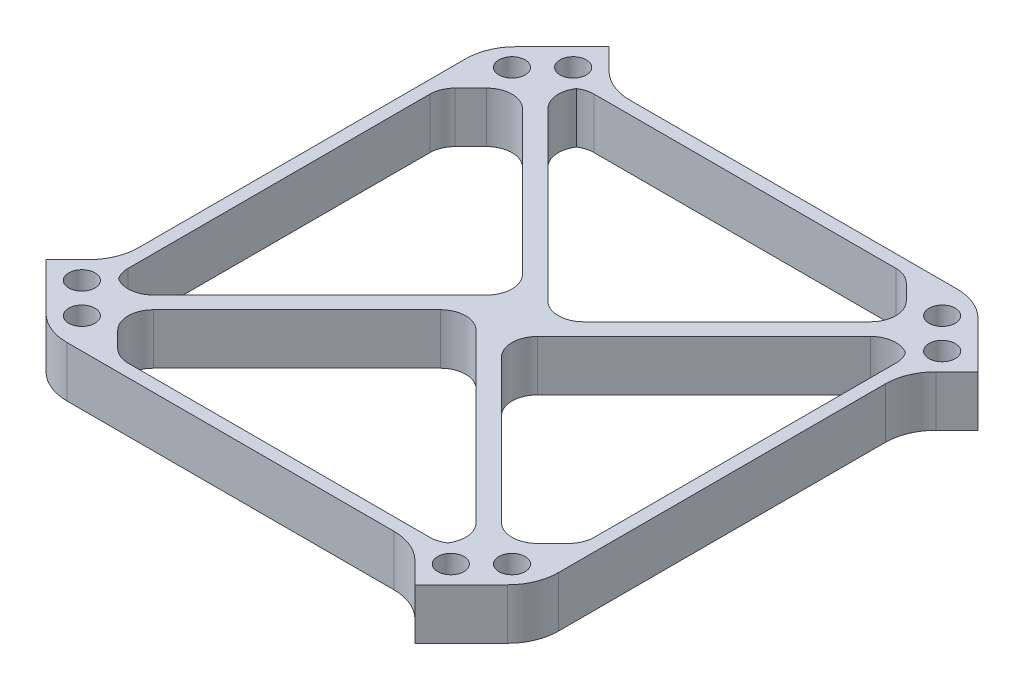
from build123d import *

# Parameters (mm, degrees)
BOSS_EXTRUDE1_DEPTH        = 10
CUT_EXTRUDE1_DEPTH         = 80.169628557
FILLET4_R                  = 5
CIRPATTERN6_COUNT          = 4
FILLET4_OF_CIRPATTERN6_R   = 5
FILLET5_R                  = 10
F_6_0_204_DIAMETER_HOLE1_D = 5.1816
CIRPATTERN7_COUNT          = 4


with BuildPart() as part:
    # Sketch1 → Boss-Extrude1 (new body)
    with BuildSketch(Plane(origin=(0, 0, 0), x_dir=(1, 0, 0), z_dir=(0, 1, 0))):
        Polygon((-48.461940777, 43.461940777), (-36.390872965, 55.533008589), (-29.319805153, 48.461940777), (43.461940777, 48.461940777), (55.533008589, 36.390872965), (48.461940777, 29.319805153), (48.461940777, -43.461940777), (36.390872965, -55.533008589), (29.319805153, -48.461940777), (-43.461940777, -48.461940777), (-55.533008589, -36.390872965), (-48.461940777, -29.319805153), align=None)
    extrude(amount=BOSS_EXTRUDE1_DEPTH)

    # Sketch2 → Cut-Extrude1 (cut, through all)
    with BuildSketch(Plane(origin=(0, 10, 0), x_dir=(1, 0, 0), z_dir=(0, 1, 0))):
        Polygon((-2.5, 4.571067812), (-42.426406871, -35.355339059), (-45.961940777, -31.819805153), (-45.961940777, 31.819805153), (-37.855339059, 39.926406871), align=None)
    cut_extrude1 = extrude(amount=-CUT_EXTRUDE1_DEPTH, mode=Mode.SUBTRACT)

    # Fillet4
    # the kernel refuses this fillet: 5 mm, written as the material it adds along each edge
    with BuildSketch(Plane(origin=(-37.855339059, 10, -39.926406871), x_dir=(-0.7071067811865468, 0, 0.7071067811865482), z_dir=(0, -1, 0)), Plane(origin=(-2.5, 10, -4.571067812), x_dir=(-0.7071067811865471, 0, -0.707106781186548), z_dir=(0, -1, 0))) as fillet4_piece_1:
        with BuildLine():
            CenterArc((FILLET4_R, -FILLET4_R), FILLET4_R, 90, 90)
            Line((0, -FILLET4_R), (0, 0))
            Line((0, 0), (FILLET4_R, 0))
        make_face()
    extrude(amount=10)
    with BuildSketch(Plane(origin=(-45.961940777, 10, 31.819805153), x_dir=(0.7071067811865467, 0, 0.7071067811865483), z_dir=(0, -1, 0)), Plane(origin=(-45.961940777, 10, -31.819805153), x_dir=(0, 0, 1), z_dir=(0, -1, 0))) as fillet4_piece_2:
        with BuildLine():
            CenterArc((FILLET4_R * 0.414213562373, -FILLET4_R), FILLET4_R, 90, 45)
            Line((-FILLET4_R * 0.292893218813, -FILLET4_R * 0.292893218813), (0, 0))
            Line((0, 0), (FILLET4_R * 0.414213562373, 0))
        make_face()
    extrude(amount=10)
    with BuildSketch(Plane(origin=(-42.426406871, 10, 35.355339059), x_dir=(-0.707106781186546, 0, -0.7071067811865489), z_dir=(0, -1, 0))) as fillet4_piece_3:
        with BuildLine():
            CenterArc((FILLET4_R, FILLET4_R), FILLET4_R, 180, 90)
            Line((0, FILLET4_R), (0, 0))
            Line((0, 0), (FILLET4_R, 0))
        make_face()
    extrude(amount=10)

    # CirPattern6: Cut-Extrude1 ×4 about axis
    cirpattern6_axis = Axis((0, 0, 0), (0, 1, 0))
    for i in range(1, CIRPATTERN6_COUNT):
        add(cut_extrude1.rotate(cirpattern6_axis, i * 360 / CIRPATTERN6_COUNT), mode=Mode.SUBTRACT)

    # Fillet4 of CirPattern6
    # the kernel refuses this fillet: 5 mm, written as the material it adds along each edge
    with BuildSketch(Plane(origin=(-39.926406871, 10, 37.855339059), x_dir=(0.7071067811865476, 0, -0.7071067811865476), z_dir=(0, -1, 0)), Plane(origin=(37.855339059, 10, 39.926406871), x_dir=(-0.7071067811865475, 0, -0.7071067811865475), z_dir=(0, -1, 0)), Plane(origin=(39.926406871, 10, -37.855339059), x_dir=(-0.7071067811865476, 0, 0.7071067811865476), z_dir=(0, -1, 0)), Plane(origin=(-35.355339059, 10, -42.426406871), x_dir=(0.7071067811865486, 0, -0.7071067811865465), z_dir=(0, -1, 0))) as fillet4_of_cirpattern6_piece_1:
        with BuildLine():
            CenterArc((FILLET4_OF_CIRPATTERN6_R, FILLET4_OF_CIRPATTERN6_R), FILLET4_OF_CIRPATTERN6_R, 180, 90)
            Line((0, FILLET4_OF_CIRPATTERN6_R), (0, 0))
            Line((0, 0), (FILLET4_OF_CIRPATTERN6_R, 0))
        make_face()
    extrude(amount=10)
    with BuildSketch(Plane(origin=(-4.571067812, 10, 2.5), x_dir=(-0.707106781186548, 0, 0.7071067811865469), z_dir=(0, -1, 0)), Plane(origin=(35.355339059, 10, 42.426406871), x_dir=(-0.7071067811865479, 0, -0.7071067811865471), z_dir=(0, -1, 0)), Plane(origin=(2.5, 10, 4.571067812), x_dir=(0.7071067811865474, 0, 0.7071067811865478), z_dir=(0, -1, 0)), Plane(origin=(42.426406871, 10, -35.355339059), x_dir=(-0.7071067811865471, 0, 0.7071067811865479), z_dir=(0, -1, 0)), Plane(origin=(4.571067812, 10, -2.5), x_dir=(0.7071067811865478, 0, -0.7071067811865472), z_dir=(0, -1, 0))) as fillet4_of_cirpattern6_piece_2:
        with BuildLine():
            CenterArc((FILLET4_OF_CIRPATTERN6_R, -FILLET4_OF_CIRPATTERN6_R), FILLET4_OF_CIRPATTERN6_R, 90, 90)
            Line((0, -FILLET4_OF_CIRPATTERN6_R), (0, 0))
            Line((0, 0), (FILLET4_OF_CIRPATTERN6_R, 0))
        make_face()
    extrude(amount=10)
    with BuildSketch(Plane(origin=(31.819805153, 10, 45.961940777), x_dir=(-1, 0, 0), z_dir=(0, -1, 0)), Plane(origin=(-31.819805153, 10, 45.961940777), x_dir=(-0.7071067811865483, 0, -0.7071067811865467), z_dir=(0, -1, 0)), Plane(origin=(45.961940777, 10, -31.819805153), x_dir=(0, 0, 1), z_dir=(0, -1, 0)), Plane(origin=(45.961940777, 10, 31.819805153), x_dir=(-0.7071067811865458, 0, 0.7071067811865492), z_dir=(0, -1, 0)), Plane(origin=(-31.819805153, 10, -45.961940777), x_dir=(1, 0, 0), z_dir=(0, -1, 0)), Plane(origin=(31.819805153, 10, -45.961940777), x_dir=(0.7071067811865492, 0, 0.7071067811865458), z_dir=(0, -1, 0))) as fillet4_of_cirpattern6_piece_3:
        with BuildLine():
            CenterArc((FILLET4_OF_CIRPATTERN6_R * 0.414213562373, FILLET4_OF_CIRPATTERN6_R), FILLET4_OF_CIRPATTERN6_R, 225, 45)
            Line((-FILLET4_OF_CIRPATTERN6_R * 0.292893218813, FILLET4_OF_CIRPATTERN6_R * 0.292893218813), (0, 0))
            Line((0, 0), (FILLET4_OF_CIRPATTERN6_R * 0.414213562373, 0))
        make_face()
    extrude(amount=10)

    # Fillet5
    fillet5_edges = [part.edges().sort_by_distance(p)[0] for p in [
        (-48.461940777, 5, -43.461940777),
        (-29.319805153, 5, -48.461940777),
        (43.461940777, 5, -48.461940777),
        (48.461940777, 5, -29.319805153),
        (48.461940777, 5, 43.461940777),
        (29.319805153, 5, 48.461940777),
        (-43.461940777, 5, 48.461940777),
        (-48.461940777, 5, 29.319805153),
    ]]
    fillet(fillet5_edges, radius=FILLET5_R)

    # #6 (0.204) Diameter Hole1 (through all)
    with Locations(Plane(origin=(0, 10, 0), x_dir=(1, 0, 0), z_dir=(0, 1, 0))):
        with Locations((-42.426406871, 42.426406871), (-36.390872965, 48.461940777)):
            f_6_0_204_diameter_hole1 = Hole(F_6_0_204_DIAMETER_HOLE1_D / 2)

    # CirPattern7: #6 (0.204) Diameter Hole1 ×4 about axis
    cirpattern7_axis = Axis((0, 0, 0), (0, 1, 0))
    for i in range(1, CIRPATTERN7_COUNT):
        add(f_6_0_204_diameter_hole1.rotate(cirpattern7_axis, i * 360 / CIRPATTERN7_COUNT), mode=Mode.SUBTRACT)


solid = part.part
